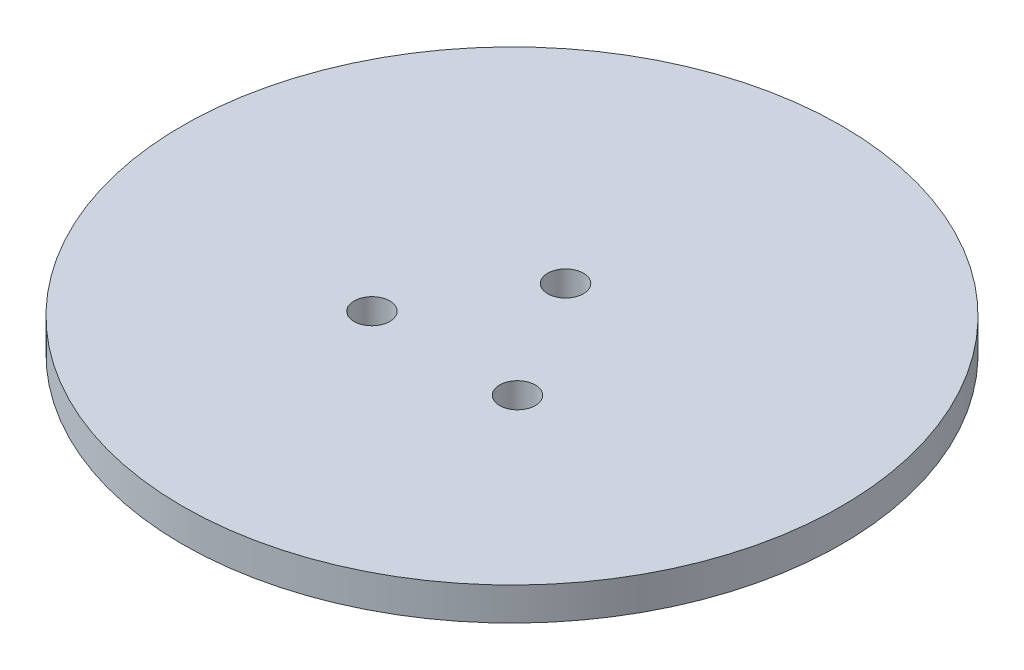
from build123d import *

# Parameters (mm, degrees)
SKETCH1_R      = 60.96
SKETCH1_R_2    = 3.302
EXTRUDE1_DEPTH = 6.096


with BuildPart() as part:
    # Sketch1 → Extrude1 (new body)
    with BuildSketch(Plane(origin=(0, 0, 0), x_dir=(1, 0, 0), z_dir=(0, 1, 0))):
        Circle(SKETCH1_R)
        with Locations((-0.254, 10.16)):
            Circle(SKETCH1_R_2, mode=Mode.SUBTRACT)
        with Locations((-13.716, -12.192)):
            Circle(SKETCH1_R_2, mode=Mode.SUBTRACT)
        with Locations((13.208, -12.192)):
            Circle(SKETCH1_R_2, mode=Mode.SUBTRACT)
    extrude(amount=EXTRUDE1_DEPTH)


solid = part.part
